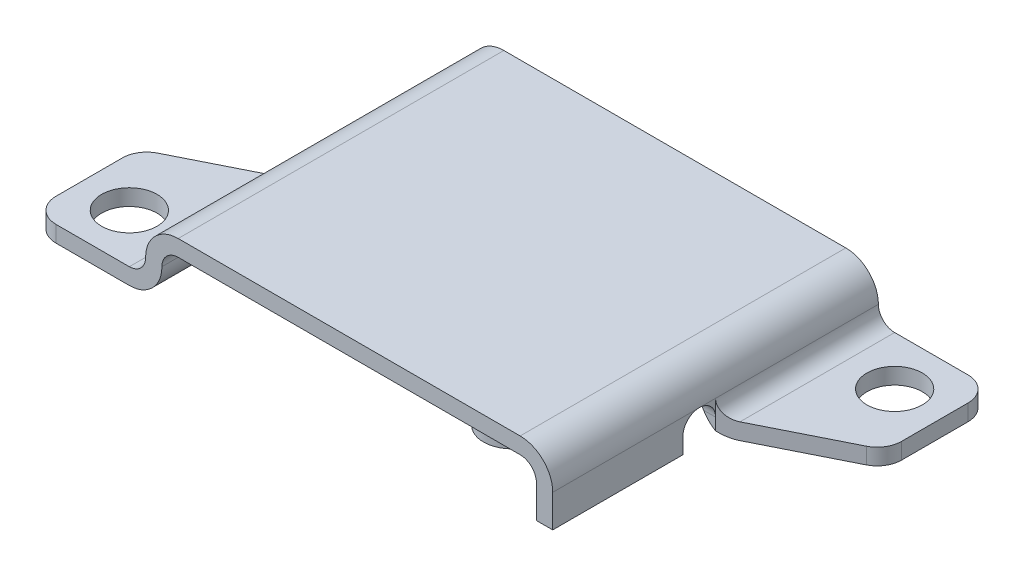
from build123d import *

# Parameters (mm, degrees)
BOSS_EXTRUDE1_DEPTH = 10
CUT_EXTRUDE1_DEPTH  = 1
CIRPATTERN1_COUNT   = 2
CIRPATTERN1_ANGLE   = 180
BOSS_EXTRUDE2_DEPTH = 1
CIRPATTERN2_COUNT   = 2
CIRPATTERN2_ANGLE   = 180
FILLET1_R           = 1.5
FILLET2_R           = 1
FILLET3_R           = 2
SKETCH5_R           = 1.7
CUT_EXTRUDE2_DEPTH  = 23.276669473
SKETCH6_R           = 1.75
BOSS_EXTRUDE3_DEPTH = 1


# Some blends are built 0.0001 mm under size
with BuildPart() as part:
    # Sketch1 → Boss-Extrude1 (new, symmetric)
    with BuildSketch(Plane.XY):
        Polygon((-12.5, -4), (-12.5, 0), (12.5, 0), (12.5, -4), (11.5, -4), (11.5, -1), (-11.5, -1), (-11.5, -4), align=None)
    extrude(amount=BOSS_EXTRUDE1_DEPTH, both=True)

    # Sketch3 → Cut-Extrude1 (cut)
    with BuildSketch(Plane(origin=(12.5, 0, 0), x_dir=(0, 0, -1), z_dir=(1, 0, 0))):
        with BuildLine():
            Line((-2, -3), (-2, -4))
            Line((-2, -4), (0, -4))
            Line((0, -4), (0, -3))
            ThreePointArc((0, -3), (-1, -2), (-2, -3))
        make_face()
    cut_extrude1 = extrude(amount=-CUT_EXTRUDE1_DEPTH, mode=Mode.SUBTRACT)

    # CirPattern1: Cut-Extrude1 ×2 about axis
    cirpattern1_axis = Axis((0, -50, 0), (0, 1, 0))
    for i in range(1, CIRPATTERN1_COUNT):
        add(cut_extrude1.rotate(cirpattern1_axis, i * CIRPATTERN1_ANGLE / (CIRPATTERN1_COUNT - 1)), mode=Mode.SUBTRACT)

    # Sketch4 → Boss-Extrude2 (add)
    with BuildSketch(Plane.XZ.offset(4)):
        Polygon((12.5, -10), (19.5, -10), (19.5, -3.5), (12.5, 0), align=None)
    boss_extrude2 = extrude(amount=-BOSS_EXTRUDE2_DEPTH)

    # CirPattern2: Boss-Extrude2 ×2 about axis
    cirpattern2_axis = Axis((0, 0, 0), (0, 1, 0))
    for i in range(1, CIRPATTERN2_COUNT):
        add(boss_extrude2.rotate(cirpattern2_axis, i * CIRPATTERN2_ANGLE / (CIRPATTERN2_COUNT - 1)))

    # Fillet1
    fillet1_edges = [part.edges().sort_by_distance(p)[0] for p in [
        (19.5, -3.5, -3.5),
        (19.5, -3.5, -10),
        (-19.5, -3.5, 3.5),
        (-19.5, -3.5, 10),
    ]]
    fillet(fillet1_edges, radius=FILLET1_R)

    # Fillet2
    # the kernel refuses this fillet: 1 mm, written as the material it adds along each edge
    with BuildSketch(Plane(origin=(11.5, -1, 10), x_dir=(0, -1, 0), z_dir=(0, 0, -1))) as fillet2_piece_1:
        with BuildLine():
            CenterArc((FILLET2_R, FILLET2_R), FILLET2_R, 180, 90)
            Line((0, FILLET2_R), (0, 0))
            Line((0, 0), (FILLET2_R, 0))
        make_face()
    extrude(amount=20)
    with BuildSketch(Plane(origin=(-11.5, -1, -10), x_dir=(1, 0, 0), z_dir=(0, 0, 1))) as fillet2_piece_2:
        with BuildLine():
            CenterArc((FILLET2_R, -FILLET2_R), FILLET2_R, 90, 90)
            Line((0, -FILLET2_R), (0, 0))
            Line((0, 0), (FILLET2_R, 0))
        make_face()
    extrude(amount=20)
    with BuildSketch(Plane(origin=(-12.5, -3, -2.5), x_dir=(0, 1, 0), z_dir=(0, 0, 1))) as fillet2_piece_3_section:
        with BuildLine():
            CenterArc((FILLET2_R, FILLET2_R), FILLET2_R, 180, 90)
            Line((0, FILLET2_R), (0, 0))
            Line((0, 0), (FILLET2_R, 0))
        make_face()
    fillet2_piece_3 = extrude(amount=12.5, mode=Mode.PRIVATE)
    fillet2_piece_3 = split(fillet2_piece_3, bisect_by=Plane(origin=(-14.699431135, -2.775586215, 1.099715568), z_dir=(0.44721359549996453, 0, 0.8944271909999126)), keep=Keep.TOP, mode=Mode.PRIVATE)
    add(fillet2_piece_3)
    with BuildSketch(Plane(origin=(12.5, -3, 2.5), x_dir=(1, 0, 0), z_dir=(0, 0, -1))) as fillet2_piece_4_section:
        with BuildLine():
            CenterArc((FILLET2_R, -FILLET2_R), FILLET2_R, 90, 90)
            Line((0, -FILLET2_R), (0, 0))
            Line((0, 0), (FILLET2_R, 0))
        make_face()
    fillet2_piece_4 = extrude(amount=12.5, mode=Mode.PRIVATE)
    fillet2_piece_4 = split(fillet2_piece_4, bisect_by=Plane(origin=(14.699431135, -2.775586215, -1.099715568), z_dir=(-0.44721359549995826, 0, -0.8944271909999157)), keep=Keep.TOP, mode=Mode.PRIVATE)
    add(fillet2_piece_4)

    # Fillet3
    fillet3_edges = [part.edges().sort_by_distance(p)[0] for p in [
        (-12.5, 0, 0),
        (12.5, 0, 0),
        (11.5, -4, -5),
        (-11.5, -4, 5),
    ]]
    fillet(fillet3_edges, radius=FILLET3_R - 0.0001)  # a hair under: the kernel refuses the full size

    # Sketch5 → Cut-Extrude2 (cut, through all)
    with BuildSketch(Plane(origin=(0, 0, 0), x_dir=(1, 0, 0), z_dir=(0, 1, 0))):
        with Locations(Location((16.5, 7, 0), (0, 0, 270))):
            Circle(SKETCH5_R)
        with Locations(Location((-16.5, -7, 0), (0, 0, 270))):
            Circle(SKETCH5_R)
    extrude(amount=-CUT_EXTRUDE2_DEPTH, mode=Mode.SUBTRACT)

    # Sketch6 → Boss-Extrude3 (add)
    with BuildSketch(Plane.XZ.offset(1)):
        with Locations(Location((7.7, 7.7, 0), (0, 0, 90))):
            Circle(SKETCH6_R)
        with Locations(Location((-7.7, -7.7, 0), (0, 0, 90))):
            Circle(SKETCH6_R)
    extrude(amount=BOSS_EXTRUDE3_DEPTH)


solid = part.part
